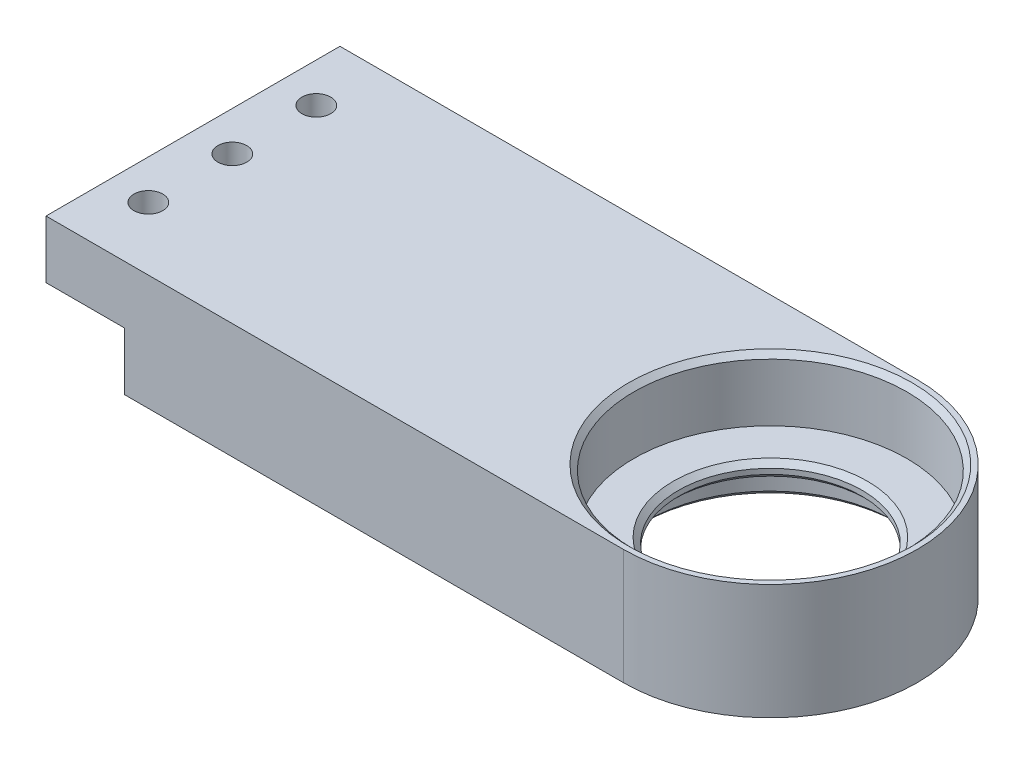
from build123d import *

# Parameters (mm, degrees)
EXTRUDE_1_DEPTH     = 22
CUT_EXTRUDE_1_REACH = 127.379
SKETCH_2_W          = 15
SKETCH_2_H          = 11
SKETCH_3_R          = 26
CUT_EXTRUDE_2_DEPTH = 12
CUT_EXTRUDE_3_REACH = 116.14
SKETCH_4_R          = 17.5
SKETCH_5_R          = 23.5
CUT_EXTRUDE_4_DEPTH = 7
CHAMFER_1_SIZE      = 1
CUT_EXTRUDE_5_REACH = 117.62
SKETCH_6_R          = 2.75


with BuildPart() as part:
    # 草图1 → 凸台-拉伸1 (new body)
    with BuildSketch(Plane(origin=(0, 0, 0), x_dir=(1, 0, 0), z_dir=(0, 1, 0))):
        with BuildLine():
            Line((0, 28), (-110, 28))
            Line((-110, 28), (-110, -28))
            Line((-110, -28), (0, -28))
            ThreePointArc((0, -28), (28, 0), (0, 28))
        make_face()
    extrude(amount=EXTRUDE_1_DEPTH)

    # 草图2 → 切除-拉伸1 (cut, up to next)
    with BuildSketch(Plane.XY.offset(28), mode=Mode.PRIVATE) as cut_extrude_1_sk1:
        with Locations((-102.5, 5.5)):
            Rectangle(SKETCH_2_W, SKETCH_2_H)
    cut_extrude_1_tool1 = extrude(cut_extrude_1_sk1.sketch, amount=-CUT_EXTRUDE_1_REACH, mode=Mode.PRIVATE) & part.part
    add(cut_extrude_1_tool1.solids().sort_by_distance((-102.5, 5.5, 28))[0], mode=Mode.SUBTRACT)

    # 草图3 → 切除-拉伸2 (cut)
    with BuildSketch(Plane(origin=(0, 22, 0), x_dir=(1, 0, 0), z_dir=(0, 1, 0))):
        Circle(SKETCH_3_R)
    extrude(amount=-CUT_EXTRUDE_2_DEPTH, mode=Mode.SUBTRACT)

    # 草图4 → 切除-拉伸3 (cut, up to next)
    with BuildSketch(Plane(origin=(0, 10, 0), x_dir=(1, 0, 0), z_dir=(0, 1, 0)), mode=Mode.PRIVATE) as cut_extrude_3_sk1:
        Circle(SKETCH_4_R)
    cut_extrude_3_tool1 = extrude(cut_extrude_3_sk1.sketch, amount=-CUT_EXTRUDE_3_REACH, mode=Mode.PRIVATE) & part.part
    add(cut_extrude_3_tool1.solids().sort_by_distance((0, 10, 0))[0], mode=Mode.SUBTRACT)

    # 草图5 → 切除-拉伸4 (cut)
    with BuildSketch(Plane.XZ):
        Circle(SKETCH_5_R)
    extrude(amount=-CUT_EXTRUDE_4_DEPTH, mode=Mode.SUBTRACT)

    # 倒角1
    chamfer_1_edges = [part.edges().sort_by_distance(p)[0] for p in [
        (-26, 22, 0),
        (-23.5, 0, 0),
        (-17.5, 7, 0),
        (-17.5, 10, 0),
    ]]
    chamfer(chamfer_1_edges, length=CHAMFER_1_SIZE)

    # 草图6 → 切除-拉伸5 (cut, up to next)
    with BuildSketch(Plane(origin=(0, 22, 0), x_dir=(1, 0, 0), z_dir=(0, 1, 0)), mode=Mode.PRIVATE) as cut_extrude_5_sk1:
        with Locations((-102.5, 0)):
            Circle(SKETCH_6_R)
    cut_extrude_5_tool1 = extrude(cut_extrude_5_sk1.sketch, amount=-CUT_EXTRUDE_5_REACH, mode=Mode.PRIVATE) & part.part
    # 草图6 → 切除-拉伸5 (cut, up to next)
    with BuildSketch(Plane(origin=(0, 22, 0), x_dir=(1, 0, 0), z_dir=(0, 1, 0)), mode=Mode.PRIVATE) as cut_extrude_5_sk2:
        with Locations((-102.5, 16)):
            Circle(SKETCH_6_R)
    cut_extrude_5_tool2 = extrude(cut_extrude_5_sk2.sketch, amount=-CUT_EXTRUDE_5_REACH, mode=Mode.PRIVATE) & part.part
    # 草图6 → 切除-拉伸5 (cut, up to next)
    with BuildSketch(Plane(origin=(0, 22, 0), x_dir=(1, 0, 0), z_dir=(0, 1, 0)), mode=Mode.PRIVATE) as cut_extrude_5_sk3:
        with Locations((-102.5, -16)):
            Circle(SKETCH_6_R)
    cut_extrude_5_tool3 = extrude(cut_extrude_5_sk3.sketch, amount=-CUT_EXTRUDE_5_REACH, mode=Mode.PRIVATE) & part.part
    add(cut_extrude_5_tool1.solids().sort_by_distance((-102.5, 22, 0))[0], mode=Mode.SUBTRACT)
    add(cut_extrude_5_tool2.solids().sort_by_distance((-102.5, 22, -16))[0], mode=Mode.SUBTRACT)
    add(cut_extrude_5_tool3.solids().sort_by_distance((-102.5, 22, 16))[0], mode=Mode.SUBTRACT)


solid = part.part
